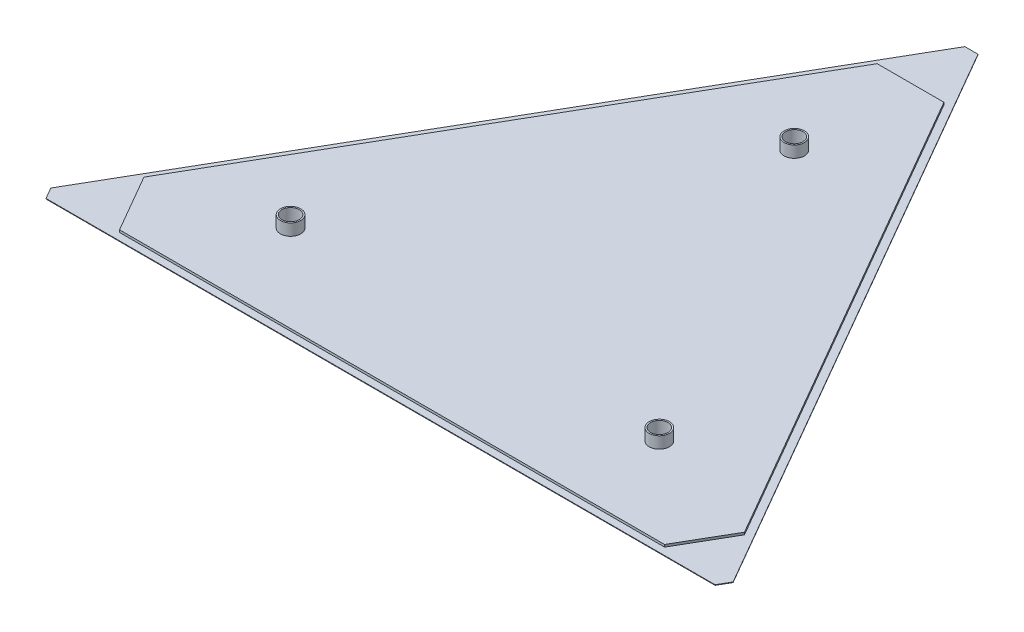
from build123d import *

# Parameters (mm, degrees)
SKETCH1_R             = 3
SKETCH1_R_2           = 1.5
BOSS_EXTRUDE1_DEPTH   = 0.2
BOSS_EXTRUDE1_2_DEPTH = 0.2
BOSS_EXTRUDE1_3_DEPTH = 0.2
BOSS_EXTRUDE1_4_DEPTH = 0.2
SKETCH1_14_R          = 3.5
BOSS_EXTRUDE2_DEPTH   = 1
SKETCH1_17_R          = 3.5
SKETCH1_17_R_2        = 3
BOSS_EXTRUDE4_DEPTH   = 5


with BuildPart() as part:
    # Sketch1 → Boss-Extrude1 (new body)
    with BuildSketch(Plane(origin=(0, 0, 0), x_dir=(1, 0, 0), z_dir=(0, 1, 0))):
        with Locations((347.273609729, 3.609230825)):
            Circle(SKETCH1_R)
        with Locations((347.273609729, 3.609230825)):
            Circle(SKETCH1_R_2, mode=Mode.SUBTRACT)
    extrude(amount=BOSS_EXTRUDE1_DEPTH)



with BuildPart() as body_2:
    # Sketch1 → Boss-Extrude1 2 (new body)
    with BuildSketch(Plane(origin=(0, 0, 0), x_dir=(1, 0, 0), z_dir=(0, 1, 0))):
        with Locations((410.793152563, -106.417182487)):
            Circle(SKETCH1_R)
        with Locations((410.793152563, -106.417182487)):
            Circle(SKETCH1_R_2, mode=Mode.SUBTRACT)
    extrude(amount=BOSS_EXTRUDE1_2_DEPTH)


with BuildPart() as body_3:
    # Sketch1 → Boss-Extrude1 3 (new body)
    with BuildSketch(Plane(origin=(0, 0, 0), x_dir=(1, 0, 0), z_dir=(0, 1, 0))):
        with Locations((283.758521159, -106.426112565)):
            Circle(SKETCH1_R)
        with Locations((283.758521159, -106.426112565)):
            Circle(SKETCH1_R_2, mode=Mode.SUBTRACT)
    extrude(amount=BOSS_EXTRUDE1_3_DEPTH)


with BuildPart() as body_4:
    # Sketch1 → Boss-Extrude1 4 (new body)
    with BuildSketch(Plane(origin=(0, 0, 0), x_dir=(1, 0, 0), z_dir=(0, 1, 0))):
        Polygon((231.981171214, -138.914415757), (229.712705007, -134.986323544), (344.980692969, 64.663360453), (349.516789508, 64.663360453), (464.784783451, -134.986661544), (462.517056767, -138.914415757), align=None)
        Polygon((243.304219773, -116.484791866), (254.809280576, -136.408896139), (442.602090749, -136.409305398), (452.699916625, -118.984688015), (358.778179035, 43.666038066), (335.767496284, 43.666038066), align=None, mode=Mode.SUBTRACT)
    extrude(amount=BOSS_EXTRUDE1_4_DEPTH)

    # Sketch1<14> → Boss-Extrude2 (add)
    # profile 1 of 2: a face of its own
    with BuildSketch(Plane(origin=(0, 0, 0), x_dir=(1, 0, 0), z_dir=(0, 1, 0))):
        Polygon((335.767496284, 43.666038066), (243.304219773, -116.484791866), (254.809280576, -136.408896139), (442.602090749, -136.409305398), (452.699916625, -118.984688015), (358.778179035, 43.666038066), align=None)
        with Locations((283.758521159, -106.426112565)):
            Circle(SKETCH1_14_R, mode=Mode.SUBTRACT)
        with Locations((410.793152563, -106.417182487)):
            Circle(SKETCH1_14_R, mode=Mode.SUBTRACT)
        with Locations((347.273609729, 3.609230825)):
            Circle(SKETCH1_14_R, mode=Mode.SUBTRACT)
    # profile 2 of 2: a face of its own
    with BuildSketch(Plane(origin=(0, 0, 0), x_dir=(1, 0, 0), z_dir=(0, 1, 0))):
        Polygon((335.767496284, 43.666038066), (243.304219773, -116.484791866), (254.809280576, -136.408896139), (442.602090749, -136.409305398), (452.699916625, -118.984688015), (358.778179035, 43.666038066), align=None)
        with Locations((283.758521159, -106.426112565)):
            Circle(SKETCH1_14_R, mode=Mode.SUBTRACT)
        with Locations((410.793152563, -106.417182487)):
            Circle(SKETCH1_14_R, mode=Mode.SUBTRACT)
        with Locations((347.273609729, 3.609230825)):
            Circle(SKETCH1_14_R, mode=Mode.SUBTRACT)
    extrude(amount=BOSS_EXTRUDE2_DEPTH)


with BuildPart() as part_1:
    add(part.part)

    add(body_2.part)  # Boss-Extrude4 merges body 2

    add(body_3.part)  # Boss-Extrude4 merges body 3

    add(body_4.part)  # Boss-Extrude4 merges body 4
    # Sketch1<17> → Boss-Extrude4 (add)
    # profile 1 of 3: a face of its own
    with BuildSketch(Plane(origin=(0, 0, 0), x_dir=(1, 0, 0), z_dir=(0, 1, 0))):
        with Locations((347.273609729, 3.609230825)):
            Circle(SKETCH1_17_R)
        with Locations((347.273609729, 3.609230825)):
            Circle(SKETCH1_17_R_2, mode=Mode.SUBTRACT)
    # profile 2 of 3: a face of its own
    with BuildSketch(Plane(origin=(0, 0, 0), x_dir=(1, 0, 0), z_dir=(0, 1, 0))):
        with Locations((410.793152563, -106.417182487)):
            Circle(SKETCH1_17_R)
        with Locations((410.793152563, -106.417182487)):
            Circle(SKETCH1_17_R_2, mode=Mode.SUBTRACT)
    # profile 3 of 3: a face of its own
    with BuildSketch(Plane(origin=(0, 0, 0), x_dir=(1, 0, 0), z_dir=(0, 1, 0))):
        with Locations((283.758521159, -106.426112565)):
            Circle(SKETCH1_17_R)
        with Locations((283.758521159, -106.426112565)):
            Circle(SKETCH1_17_R_2, mode=Mode.SUBTRACT)
    extrude(amount=BOSS_EXTRUDE4_DEPTH)


solid = part_1.part
